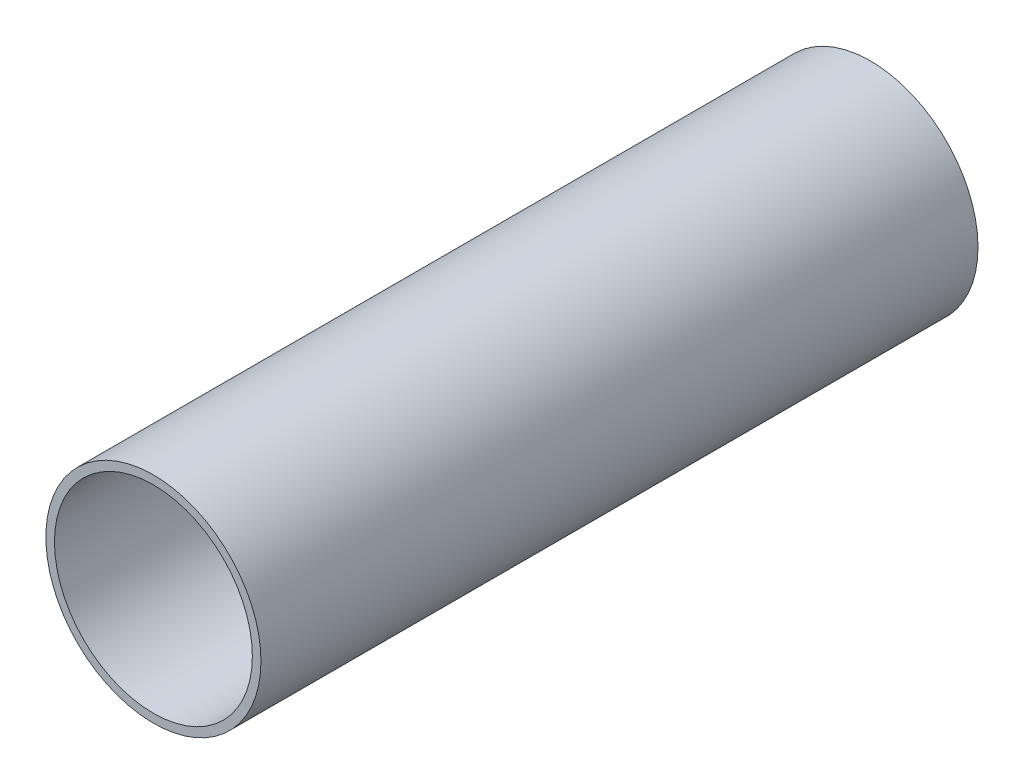
from build123d import *

# Parameters (mm, degrees)
SKIZZE1_R                    = 37.5
SKIZZE1_R_2                  = 34.5
LINEAR_AUSTRAGEN_D_NN1_DEPTH = 250


with BuildPart() as part:
    # Skizze1 → Linear-Austragen-Dünn1 (new body)
    with BuildSketch(Plane.XY):
        Circle(SKIZZE1_R)
        Circle(SKIZZE1_R_2, mode=Mode.SUBTRACT)
    extrude(amount=LINEAR_AUSTRAGEN_D_NN1_DEPTH)


solid = part.part
